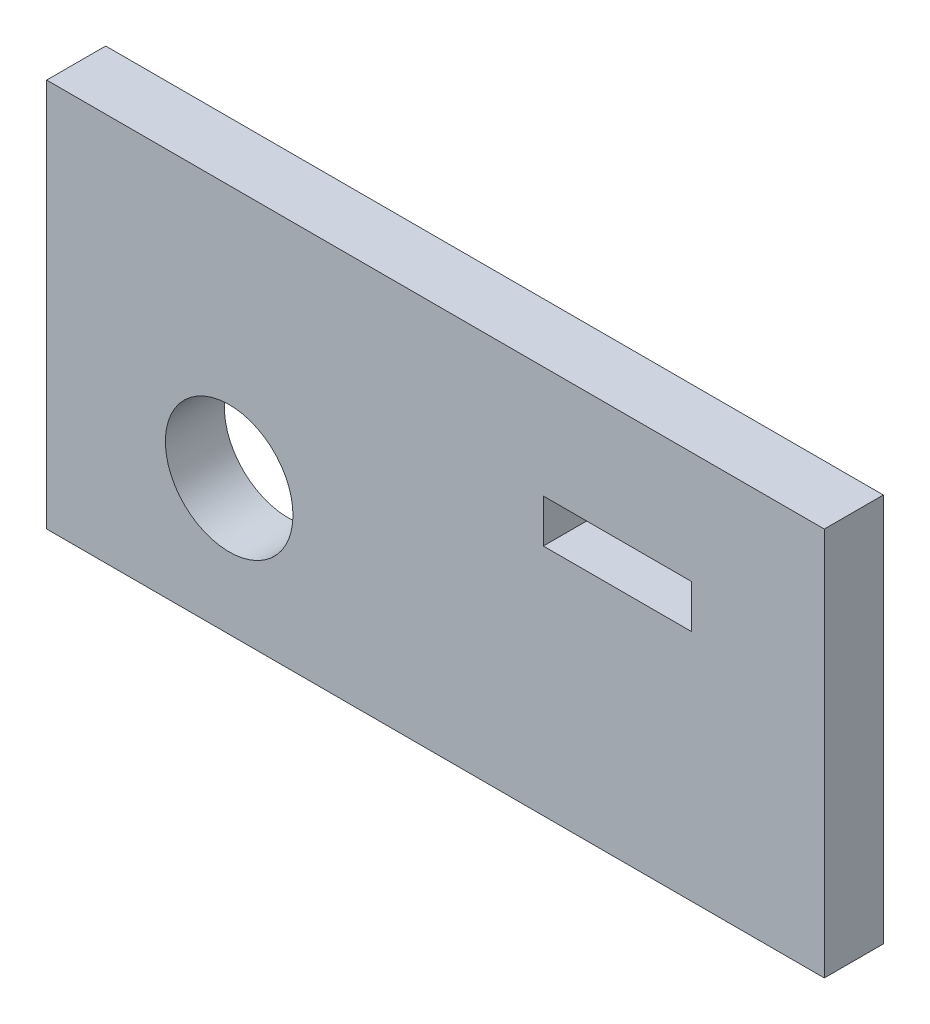
from build123d import *

# Parameters (mm, degrees)
SKETCH1_W           = 131.78232807
SKETCH1_H           = 65.891164035
SKETCH1_W_2         = 25.122990279
SKETCH1_H_2         = 7.346433981
BOSS_EXTRUDE1_DEPTH = 10
SKETCH2_R           = 10.811169671
CUT_EXTRUDE1_DEPTH  = 10


with BuildPart() as part:
    # Sketch1 → Boss-Extrude1 (new body)
    with BuildSketch(Plane.XY):
        with Locations((65.891164035, 32.945582018)):
            Rectangle(SKETCH1_W, SKETCH1_H)
        with Locations((96.72804741, 43.262333441)):
            Rectangle(SKETCH1_W_2, SKETCH1_H_2, mode=Mode.SUBTRACT)
    extrude(amount=BOSS_EXTRUDE1_DEPTH)

    # Sketch2 → Cut-Extrude1 (cut)
    with BuildSketch(Plane.XY.offset(10)):
        with Locations((30.923844671, 22.915255368)):
            Circle(SKETCH2_R)
    extrude(amount=-CUT_EXTRUDE1_DEPTH, mode=Mode.SUBTRACT)


solid = part.part
